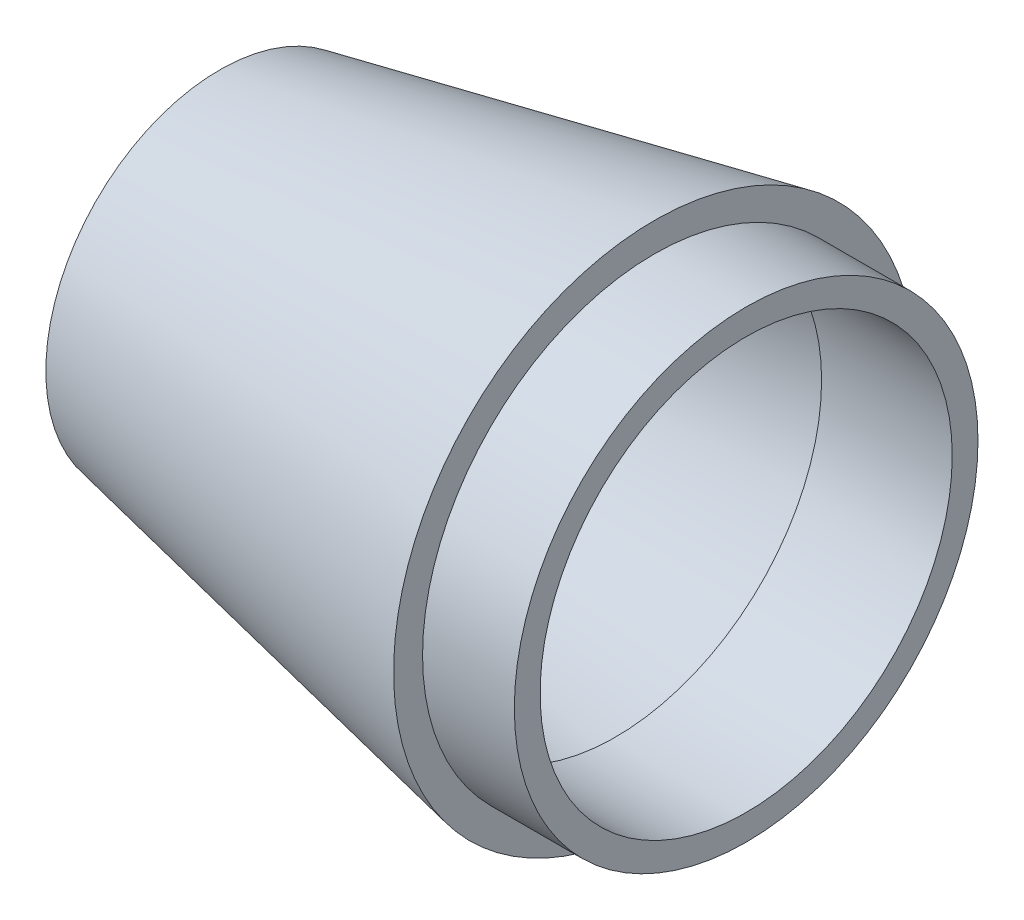
from build123d import *

# Parameters (mm, degrees)
SKETCH2_W      = 0.625748312
SKETCH2_H      = 0.221900722
REVOLVE5_ANGLE = 180


with BuildPart() as part:
    # Sketch1 → Revolve4 (revolve)
    with BuildSketch(Plane.XY):
        Polygon((-12.065, 7.62), (-12.065, 6.35), (-7.477648947, 7.267470211), (-7.477648947, 0), (-2.54, 0), (-2.54, 8.255), (5.281898446, 9.819379689), (5.281898446, 9.03062805), (11.006474791, 9.03062805), (11.006474791, 10.16), (6.985, 10.16), (6.985, 11.43), align=None)
    revolve(axis=Axis((44.726440805, 0, 0), (-1, 0, 0)))

    # Sketch2 → Revolve5 (revolve)
    with BuildSketch(Plane(origin=(-2.54, 0, 0), x_dir=(0, 0, -1), z_dir=(1, 0, 0))):
        with Locations((0, 0.897225516)):
            Rectangle(SKETCH2_W, SKETCH2_H)
    revolve(axis=Axis((-2.54, 0, 0.312874156), (0, 0, -1)), revolution_arc=REVOLVE5_ANGLE)


solid = part.part
